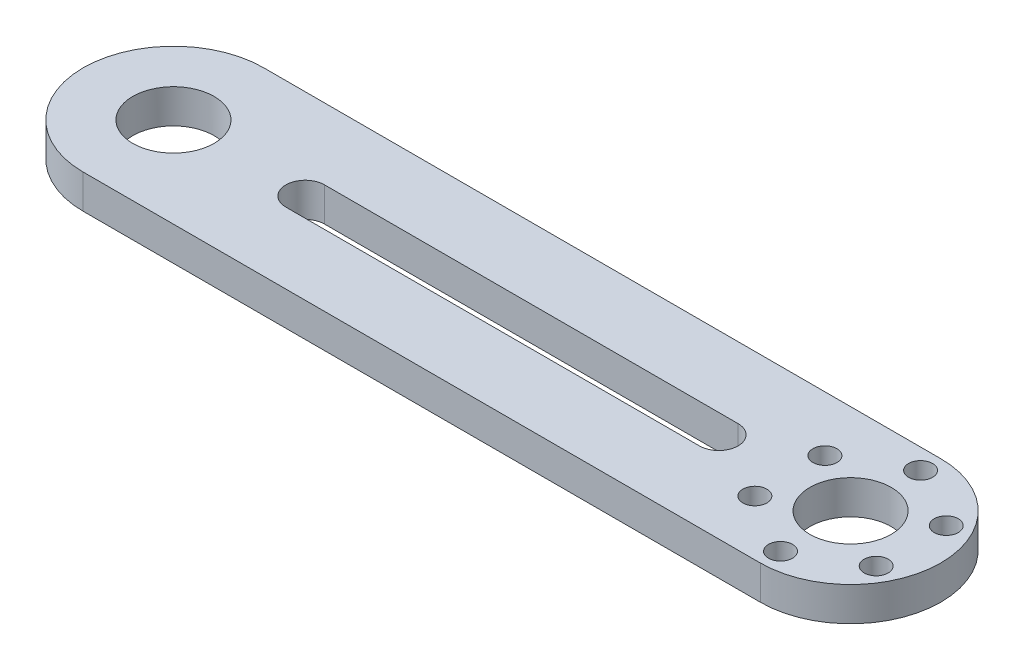
from build123d import *

# Parameters (mm, degrees)
BOSS_EXTRUDE1_DEPTH = 5.12
CUT_EXTRUDE1_REACH  = 68.214
SKETCH2_R           = 6.13
SKETCH2_R_2         = 1.81


with BuildPart() as part:
    # Sketch1 → Boss-Extrude1 (new body)
    with BuildSketch(Plane(origin=(0, 0, 0), x_dir=(1, 0, 0), z_dir=(0, 1, 0))):
        with BuildLine():
            Line((51, -13.6), (-51, -13.6))
            ThreePointArc((-51, -13.6), (-64.6, 0), (-51, 13.6))
            Line((-51, 13.6), (51, 13.6))
            ThreePointArc((51, 13.6), (64.6, 0), (51, -13.6))
        make_face()
        with BuildLine():
            Line((31.15, -2.91), (-31.15, -2.91))
            ThreePointArc((-31.15, -2.91), (-34.06, 0), (-31.15, 2.91))
            Line((-31.15, 2.91), (31.15, 2.91))
            ThreePointArc((31.15, 2.91), (34.06, 0), (31.15, -2.91))
        make_face(mode=Mode.SUBTRACT)
    extrude(amount=BOSS_EXTRUDE1_DEPTH)

    # Sketch2 → Cut-Extrude1 (cut, up to next)
    with BuildSketch(Plane(origin=(0, 5.12, 0), x_dir=(1, 0, 0), z_dir=(0, 1, 0)), mode=Mode.PRIVATE) as cut_extrude1_sk1:
        with Locations((51, 0)):
            Circle(SKETCH2_R)
    cut_extrude1_tool1 = extrude(cut_extrude1_sk1.sketch, amount=-CUT_EXTRUDE1_REACH, mode=Mode.PRIVATE) & part.part
    # Sketch2 → Cut-Extrude1 (cut, up to next)
    with BuildSketch(Plane(origin=(0, 5.12, 0), x_dir=(1, 0, 0), z_dir=(0, 1, 0)), mode=Mode.PRIVATE) as cut_extrude1_sk2:
        with Locations((51, 10.55)):
            Circle(SKETCH2_R_2)
    cut_extrude1_tool2 = extrude(cut_extrude1_sk2.sketch, amount=-CUT_EXTRUDE1_REACH, mode=Mode.PRIVATE) & part.part
    # Sketch2 → Cut-Extrude1 (cut, up to next)
    with BuildSketch(Plane(origin=(0, 5.12, 0), x_dir=(1, 0, 0), z_dir=(0, 1, 0)), mode=Mode.PRIVATE) as cut_extrude1_sk3:
        with Locations((60.13656801, 5.275)):
            Circle(SKETCH2_R_2)
    cut_extrude1_tool3 = extrude(cut_extrude1_sk3.sketch, amount=-CUT_EXTRUDE1_REACH, mode=Mode.PRIVATE) & part.part
    # Sketch2 → Cut-Extrude1 (cut, up to next)
    with BuildSketch(Plane(origin=(0, 5.12, 0), x_dir=(1, 0, 0), z_dir=(0, 1, 0)), mode=Mode.PRIVATE) as cut_extrude1_sk4:
        with Locations((60.13656801, -5.275)):
            Circle(SKETCH2_R_2)
    cut_extrude1_tool4 = extrude(cut_extrude1_sk4.sketch, amount=-CUT_EXTRUDE1_REACH, mode=Mode.PRIVATE) & part.part
    # Sketch2 → Cut-Extrude1 (cut, up to next)
    with BuildSketch(Plane(origin=(0, 5.12, 0), x_dir=(1, 0, 0), z_dir=(0, 1, 0)), mode=Mode.PRIVATE) as cut_extrude1_sk5:
        with Locations((51, -10.55)):
            Circle(SKETCH2_R_2)
    cut_extrude1_tool5 = extrude(cut_extrude1_sk5.sketch, amount=-CUT_EXTRUDE1_REACH, mode=Mode.PRIVATE) & part.part
    # Sketch2 → Cut-Extrude1 (cut, up to next)
    with BuildSketch(Plane(origin=(0, 5.12, 0), x_dir=(1, 0, 0), z_dir=(0, 1, 0)), mode=Mode.PRIVATE) as cut_extrude1_sk6:
        with Locations((41.86343199, -5.275)):
            Circle(SKETCH2_R_2)
    cut_extrude1_tool6 = extrude(cut_extrude1_sk6.sketch, amount=-CUT_EXTRUDE1_REACH, mode=Mode.PRIVATE) & part.part
    # Sketch2 → Cut-Extrude1 (cut, up to next)
    with BuildSketch(Plane(origin=(0, 5.12, 0), x_dir=(1, 0, 0), z_dir=(0, 1, 0)), mode=Mode.PRIVATE) as cut_extrude1_sk7:
        with Locations((41.86343199, 5.275)):
            Circle(SKETCH2_R_2)
    cut_extrude1_tool7 = extrude(cut_extrude1_sk7.sketch, amount=-CUT_EXTRUDE1_REACH, mode=Mode.PRIVATE) & part.part
    # Sketch2 → Cut-Extrude1 (cut, up to next)
    with BuildSketch(Plane(origin=(0, 5.12, 0), x_dir=(1, 0, 0), z_dir=(0, 1, 0)), mode=Mode.PRIVATE) as cut_extrude1_sk8:
        with Locations((-51, 0)):
            Circle(SKETCH2_R)
    cut_extrude1_tool8 = extrude(cut_extrude1_sk8.sketch, amount=-CUT_EXTRUDE1_REACH, mode=Mode.PRIVATE) & part.part
    add(cut_extrude1_tool1.solids().sort_by_distance((51, 5.12, 0))[0], mode=Mode.SUBTRACT)
    add(cut_extrude1_tool2.solids().sort_by_distance((51, 5.12, -10.55))[0], mode=Mode.SUBTRACT)
    add(cut_extrude1_tool3.solids().sort_by_distance((60.136568, 5.12, -5.275))[0], mode=Mode.SUBTRACT)
    add(cut_extrude1_tool4.solids().sort_by_distance((60.136568, 5.12, 5.275))[0], mode=Mode.SUBTRACT)
    add(cut_extrude1_tool5.solids().sort_by_distance((51, 5.12, 10.55))[0], mode=Mode.SUBTRACT)
    add(cut_extrude1_tool6.solids().sort_by_distance((41.863432, 5.12, 5.275))[0], mode=Mode.SUBTRACT)
    add(cut_extrude1_tool7.solids().sort_by_distance((41.863432, 5.12, -5.275))[0], mode=Mode.SUBTRACT)
    add(cut_extrude1_tool8.solids().sort_by_distance((-51, 5.12, 0))[0], mode=Mode.SUBTRACT)


solid = part.part
